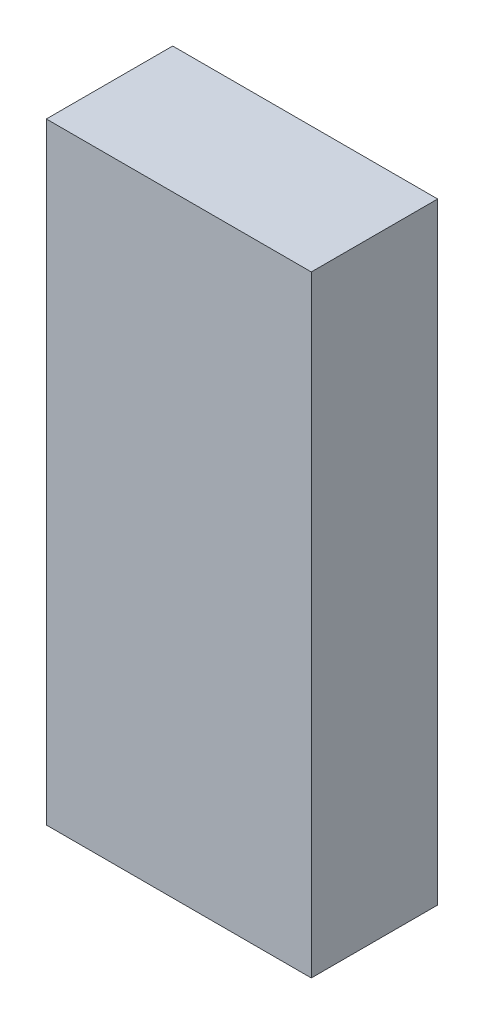
from build123d import *

# Parameters (mm, degrees)
SKETCH1_W           = 33.02
SKETCH1_H           = 76.2
BOSS_EXTRUDE1_DEPTH = 7.874


with BuildPart() as part:
    # Sketch1 → Boss-Extrude1 (new, symmetric)
    with BuildSketch(Plane.XY):
        Rectangle(SKETCH1_W, SKETCH1_H)
    extrude(amount=BOSS_EXTRUDE1_DEPTH, both=True)


solid = part.part
